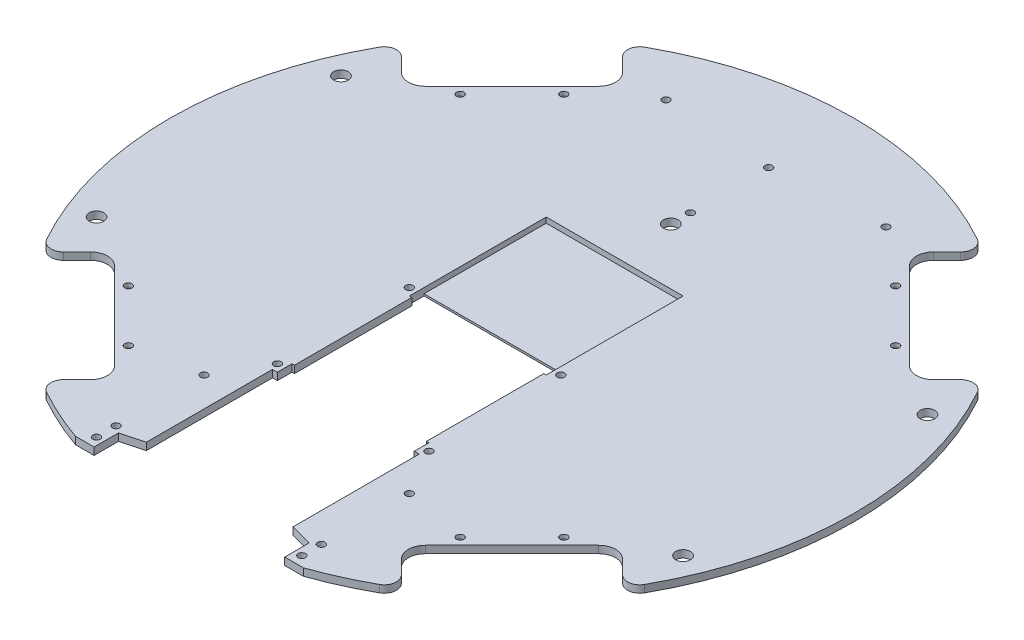
from build123d import *

# Parameters (mm, degrees)
SKETCH1_R                = 140
BOSS_EXTRUDE1_DEPTH      = 3
CUT_EXTRUDE4_REACH       = 200.013
CUT_EXTRUDE6_REACH       = 200.013
SKETCH9_R                = 1.5
FILLET1_R                = 5
CIRPATTERN1_COUNT        = 4
FILLET1_OF_CIRPATTERN1_R = 5
CUT_EXTRUDE1_REACH       = 200.013
FILLET3_R                = 1.5
CUT_EXTRUDE7_REACH       = 200.013
SKETCH10_R               = 1.5
CUT_EXTRUDE9_REACH       = 200.013
SKETCH13_R               = 1.5
CUT_EXTRUDE12_REACH      = 200.013
SKETCH16_R               = 1.5
SKETCH16_R_2             = 3
CUT_EXTRUDE13_REACH      = 200.013
SKETCH17_R               = 3
SKETCH18_W               = 56
SKETCH18_H               = 50
CUT_EXTRUDE14_DEPTH      = 2.2
CUT_EXTRUDE15_REACH      = 200.013
SKETCH19_R               = 1.5


with BuildPart() as part:
    # Sketch1 → Boss-Extrude1 (new body)
    with BuildSketch(Plane(origin=(0, 0, 0), x_dir=(1, 0, 0), z_dir=(0, 1, 0))):
        Circle(SKETCH1_R)
    extrude(amount=BOSS_EXTRUDE1_DEPTH)

    # Sketch7 → Cut-Extrude4 (cut, up to next)
    with BuildSketch(Plane(origin=(0, 3, 0), x_dir=(1, 0, 0), z_dir=(0, 1, 0)), mode=Mode.PRIVATE) as cut_extrude4_sk1:
        with BuildLine():
            Line((-99.030304705, -63.604254968), (-63.604254968, -99.030304705))
            ThreePointArc((-63.604254968, -99.030304705), (-61.568647097, -103.944696834), (-63.604254968, -108.859088964))
            Line((-63.604254968, -108.859088964), (-76.367532368, -121.622366364))
            Line((-76.367532368, -121.622366364), (-121.622366364, -76.367532368))
            Line((-121.622366364, -76.367532368), (-108.859088964, -63.604254968))
            ThreePointArc((-108.859088964, -63.604254968), (-103.944696834, -61.568647097), (-99.030304705, -63.604254968))
        make_face()
    cut_extrude4_tool1 = extrude(cut_extrude4_sk1.sketch, amount=-CUT_EXTRUDE4_REACH, mode=Mode.PRIVATE) & part.part
    cut_extrude4 = cut_extrude4_tool1.solids().sort_by_distance((-90.257735, 3, 90.257735))[0]
    add(cut_extrude4, mode=Mode.SUBTRACT)

    # Sketch9 → Cut-Extrude6 (cut, up to next)
    with BuildSketch(Plane(origin=(0, 3, 0), x_dir=(1, 0, 0), z_dir=(0, 1, 0)), mode=Mode.PRIVATE) as cut_extrude6_sk1:
        with Locations((-89.09545443, -67.882250994)):
            Circle(SKETCH9_R)
    cut_extrude6_tool1 = extrude(cut_extrude6_sk1.sketch, amount=-CUT_EXTRUDE6_REACH, mode=Mode.PRIVATE) & part.part
    # Sketch9 → Cut-Extrude6 (cut, up to next)
    with BuildSketch(Plane(origin=(0, 3, 0), x_dir=(1, 0, 0), z_dir=(0, 1, 0)), mode=Mode.PRIVATE) as cut_extrude6_sk2:
        with Locations((-67.882250994, -89.09545443)):
            Circle(SKETCH9_R)
    cut_extrude6_tool2 = extrude(cut_extrude6_sk2.sketch, amount=-CUT_EXTRUDE6_REACH, mode=Mode.PRIVATE) & part.part
    cut_extrude6_1 = cut_extrude6_tool1.solids().sort_by_distance((-89.095454, 3, 67.882251))[0]
    add(cut_extrude6_1, mode=Mode.SUBTRACT)
    cut_extrude6_2 = cut_extrude6_tool2.solids().sort_by_distance((-67.882251, 3, 89.095454))[0]
    add(cut_extrude6_2, mode=Mode.SUBTRACT)
    cut_extrude6 = cut_extrude6_1 + cut_extrude6_2  # Cut-Extrude6 as one shape, for the pattern or mirror that repeats it

    # Fillet1
    fillet1_edges = [part.edges().sort_by_distance(p)[0] for p in [
        (-73.746853427, 1.5, 119.001687423),
        (-119.001687423, 1.5, 73.746853427),
    ]]
    fillet(fillet1_edges, radius=FILLET1_R)

    # CirPattern1: Cut-Extrude4, Cut-Extrude6 ×4 about axis
    cirpattern1_axis = Axis((0, 3, 0), (0, 1, 0))
    add([cut_extrude4.rotate(cirpattern1_axis, i * 360 / CIRPATTERN1_COUNT) for i in range(1, CIRPATTERN1_COUNT)], mode=Mode.SUBTRACT)
    add([cut_extrude6.rotate(cirpattern1_axis, i * 360 / CIRPATTERN1_COUNT) for i in range(1, CIRPATTERN1_COUNT)], mode=Mode.SUBTRACT)

    # Fillet1 of CirPattern1
    fillet1_of_cirpattern1_edges = [part.edges().sort_by_distance(p)[0] for p in [
        (119.001687423, 1.5, 73.746853427),
        (73.746853427, 1.5, 119.001687423),
        (73.746853427, 1.5, -119.001687423),
        (119.001687423, 1.5, -73.746853427),
        (-119.001687423, 1.5, -73.746853427),
        (-73.746853427, 1.5, -119.001687423),
    ]]
    fillet(fillet1_of_cirpattern1_edges, radius=FILLET1_OF_CIRPATTERN1_R)

    # Sketch2 → Cut-Extrude1 (cut, up to next)
    with BuildSketch(Plane(origin=(0, 3, 0), x_dir=(1, 0, 0), z_dir=(0, 1, 0)), mode=Mode.PRIVATE) as cut_extrude1_sk1:
        Polygon((-46.647615159, -132), (-39, -132), (-39, -122), (-30, -119.588457268), (-30, -68), (-28, -68), (-28, -62), (-27, -62), (-27, -14), (-28, -14), (-28, -8), (28, -8), (28, -14), (27, -14), (27, -62), (28, -62), (28, -68), (30, -68), (30, -119.588457268), (39, -122), (39, -132), (46.647615159, -132), (46.647615159, -140), (-46.647615159, -140), align=None)
    cut_extrude1_tool1 = extrude(cut_extrude1_sk1.sketch, amount=-CUT_EXTRUDE1_REACH, mode=Mode.PRIVATE) & part.part
    add(cut_extrude1_tool1.solids().sort_by_distance((0, 3, 78.865183))[0], mode=Mode.SUBTRACT)

    # Fillet3
    fillet3_edges = [part.edges().sort_by_distance(p)[0] for p in [
        (67.882250994, 0, 90.59545443),
        (89.09545443, 0, 69.382250994),
        (90.59545443, 0, -67.882250994),
        (69.382250994, 0, -89.09545443),
        (-67.882250994, 0, -90.59545443),
        (-89.09545443, 0, -69.382250994),
        (-69.382250994, 0, 89.09545443),
        (-90.59545443, 0, 67.882250994),
    ]]
    fillet(fillet3_edges, radius=FILLET3_R)

    # Sketch10 → Cut-Extrude7 (cut, up to next)
    with BuildSketch(Plane(origin=(0, 3, 0), x_dir=(1, 0, 0), z_dir=(0, 1, 0)), mode=Mode.PRIVATE) as cut_extrude7_sk1:
        with Locations((-31, -65)):
            Circle(SKETCH10_R)
    cut_extrude7_tool1 = extrude(cut_extrude7_sk1.sketch, amount=-CUT_EXTRUDE7_REACH, mode=Mode.PRIVATE) & part.part
    # Sketch10 → Cut-Extrude7 (cut, up to next)
    with BuildSketch(Plane(origin=(0, 3, 0), x_dir=(1, 0, 0), z_dir=(0, 1, 0)), mode=Mode.PRIVATE) as cut_extrude7_sk2:
        with Locations((31, -65)):
            Circle(SKETCH10_R)
    cut_extrude7_tool2 = extrude(cut_extrude7_sk2.sketch, amount=-CUT_EXTRUDE7_REACH, mode=Mode.PRIVATE) & part.part
    # Sketch10 → Cut-Extrude7 (cut, up to next)
    with BuildSketch(Plane(origin=(0, 3, 0), x_dir=(1, 0, 0), z_dir=(0, 1, 0)), mode=Mode.PRIVATE) as cut_extrude7_sk3:
        with Locations((-31, -11)):
            Circle(SKETCH10_R)
    cut_extrude7_tool3 = extrude(cut_extrude7_sk3.sketch, amount=-CUT_EXTRUDE7_REACH, mode=Mode.PRIVATE) & part.part
    # Sketch10 → Cut-Extrude7 (cut, up to next)
    with BuildSketch(Plane(origin=(0, 3, 0), x_dir=(1, 0, 0), z_dir=(0, 1, 0)), mode=Mode.PRIVATE) as cut_extrude7_sk4:
        with Locations((31, -11)):
            Circle(SKETCH10_R)
    cut_extrude7_tool4 = extrude(cut_extrude7_sk4.sketch, amount=-CUT_EXTRUDE7_REACH, mode=Mode.PRIVATE) & part.part
    add(cut_extrude7_tool1.solids().sort_by_distance((-31, 3, 65))[0], mode=Mode.SUBTRACT)
    add(cut_extrude7_tool2.solids().sort_by_distance((31, 3, 65))[0], mode=Mode.SUBTRACT)
    add(cut_extrude7_tool3.solids().sort_by_distance((-31, 3, 11))[0], mode=Mode.SUBTRACT)
    add(cut_extrude7_tool4.solids().sort_by_distance((31, 3, 11))[0], mode=Mode.SUBTRACT)

    # Sketch13 → Cut-Extrude9 (cut, up to next)
    with BuildSketch(Plane(origin=(0, 3, 0), x_dir=(1, 0, 0), z_dir=(0, 1, 0)), mode=Mode.PRIVATE) as cut_extrude9_sk1:
        with Locations((-42, -84)):
            Circle(SKETCH13_R)
    cut_extrude9_tool1 = extrude(cut_extrude9_sk1.sketch, amount=-CUT_EXTRUDE9_REACH, mode=Mode.PRIVATE) & part.part
    # Sketch13 → Cut-Extrude9 (cut, up to next)
    with BuildSketch(Plane(origin=(0, 3, 0), x_dir=(1, 0, 0), z_dir=(0, 1, 0)), mode=Mode.PRIVATE) as cut_extrude9_sk2:
        with Locations((-42, -120)):
            Circle(SKETCH13_R)
    cut_extrude9_tool2 = extrude(cut_extrude9_sk2.sketch, amount=-CUT_EXTRUDE9_REACH, mode=Mode.PRIVATE) & part.part
    # Sketch13 → Cut-Extrude9 (cut, up to next)
    with BuildSketch(Plane(origin=(0, 3, 0), x_dir=(1, 0, 0), z_dir=(0, 1, 0)), mode=Mode.PRIVATE) as cut_extrude9_sk3:
        with Locations((42, -120)):
            Circle(SKETCH13_R)
    cut_extrude9_tool3 = extrude(cut_extrude9_sk3.sketch, amount=-CUT_EXTRUDE9_REACH, mode=Mode.PRIVATE) & part.part
    # Sketch13 → Cut-Extrude9 (cut, up to next)
    with BuildSketch(Plane(origin=(0, 3, 0), x_dir=(1, 0, 0), z_dir=(0, 1, 0)), mode=Mode.PRIVATE) as cut_extrude9_sk4:
        with Locations((42, -84)):
            Circle(SKETCH13_R)
    cut_extrude9_tool4 = extrude(cut_extrude9_sk4.sketch, amount=-CUT_EXTRUDE9_REACH, mode=Mode.PRIVATE) & part.part
    add(cut_extrude9_tool1.solids().sort_by_distance((-42, 3, 84))[0], mode=Mode.SUBTRACT)
    add(cut_extrude9_tool2.solids().sort_by_distance((-42, 3, 120))[0], mode=Mode.SUBTRACT)
    add(cut_extrude9_tool3.solids().sort_by_distance((42, 3, 120))[0], mode=Mode.SUBTRACT)
    add(cut_extrude9_tool4.solids().sort_by_distance((42, 3, 84))[0], mode=Mode.SUBTRACT)

    # Sketch16 → Cut-Extrude12 (cut, up to next)
    with BuildSketch(Plane(origin=(0, 3, 0), x_dir=(1, 0, 0), z_dir=(0, 1, 0)), mode=Mode.PRIVATE) as cut_extrude12_sk1:
        with Locations((0, 73)):
            Circle(SKETCH16_R)
    cut_extrude12_tool1 = extrude(cut_extrude12_sk1.sketch, amount=-CUT_EXTRUDE12_REACH, mode=Mode.PRIVATE) & part.part
    # Sketch16 → Cut-Extrude12 (cut, up to next)
    with BuildSketch(Plane(origin=(0, 3, 0), x_dir=(1, 0, 0), z_dir=(0, 1, 0)), mode=Mode.PRIVATE) as cut_extrude12_sk2:
        with Locations((-45, 108)):
            Circle(SKETCH16_R)
    cut_extrude12_tool2 = extrude(cut_extrude12_sk2.sketch, amount=-CUT_EXTRUDE12_REACH, mode=Mode.PRIVATE) & part.part
    # Sketch16 → Cut-Extrude12 (cut, up to next)
    with BuildSketch(Plane(origin=(0, 3, 0), x_dir=(1, 0, 0), z_dir=(0, 1, 0)), mode=Mode.PRIVATE) as cut_extrude12_sk3:
        with Locations((45, 108)):
            Circle(SKETCH16_R)
    cut_extrude12_tool3 = extrude(cut_extrude12_sk3.sketch, amount=-CUT_EXTRUDE12_REACH, mode=Mode.PRIVATE) & part.part
    # Sketch16 → Cut-Extrude12 (cut, up to next)
    with BuildSketch(Plane(origin=(0, 3, 0), x_dir=(1, 0, 0), z_dir=(0, 1, 0)), mode=Mode.PRIVATE) as cut_extrude12_sk4:
        with Locations((0, 105)):
            Circle(SKETCH16_R)
    cut_extrude12_tool4 = extrude(cut_extrude12_sk4.sketch, amount=-CUT_EXTRUDE12_REACH, mode=Mode.PRIVATE) & part.part
    # Sketch16 → Cut-Extrude12 (cut, up to next)
    with BuildSketch(Plane(origin=(0, 3, 0), x_dir=(1, 0, 0), z_dir=(0, 1, 0)), mode=Mode.PRIVATE) as cut_extrude12_sk5:
        with Locations((0, 65)):
            Circle(SKETCH16_R_2)
    cut_extrude12_tool5 = extrude(cut_extrude12_sk5.sketch, amount=-CUT_EXTRUDE12_REACH, mode=Mode.PRIVATE) & part.part
    add(cut_extrude12_tool1.solids().sort_by_distance((0, 3, -73))[0], mode=Mode.SUBTRACT)
    add(cut_extrude12_tool2.solids().sort_by_distance((-45, 3, -108))[0], mode=Mode.SUBTRACT)
    add(cut_extrude12_tool3.solids().sort_by_distance((45, 3, -108))[0], mode=Mode.SUBTRACT)
    add(cut_extrude12_tool4.solids().sort_by_distance((0, 3, -105))[0], mode=Mode.SUBTRACT)
    add(cut_extrude12_tool5.solids().sort_by_distance((0, 3, -65))[0], mode=Mode.SUBTRACT)

    # Sketch17 → Cut-Extrude13 (cut, up to next)
    with BuildSketch(Plane(origin=(0, 3, 0), x_dir=(1, 0, 0), z_dir=(0, 1, 0)), mode=Mode.PRIVATE) as cut_extrude13_sk1:
        with Locations((-120, 50)):
            Circle(SKETCH17_R)
    cut_extrude13_tool1 = extrude(cut_extrude13_sk1.sketch, amount=-CUT_EXTRUDE13_REACH, mode=Mode.PRIVATE) & part.part
    # Sketch17 → Cut-Extrude13 (cut, up to next)
    with BuildSketch(Plane(origin=(0, 3, 0), x_dir=(1, 0, 0), z_dir=(0, 1, 0)), mode=Mode.PRIVATE) as cut_extrude13_sk2:
        with Locations((-120, -50)):
            Circle(SKETCH17_R)
    cut_extrude13_tool2 = extrude(cut_extrude13_sk2.sketch, amount=-CUT_EXTRUDE13_REACH, mode=Mode.PRIVATE) & part.part
    # Sketch17 → Cut-Extrude13 (cut, up to next)
    with BuildSketch(Plane(origin=(0, 3, 0), x_dir=(1, 0, 0), z_dir=(0, 1, 0)), mode=Mode.PRIVATE) as cut_extrude13_sk3:
        with Locations((120, 50)):
            Circle(SKETCH17_R)
    cut_extrude13_tool3 = extrude(cut_extrude13_sk3.sketch, amount=-CUT_EXTRUDE13_REACH, mode=Mode.PRIVATE) & part.part
    # Sketch17 → Cut-Extrude13 (cut, up to next)
    with BuildSketch(Plane(origin=(0, 3, 0), x_dir=(1, 0, 0), z_dir=(0, 1, 0)), mode=Mode.PRIVATE) as cut_extrude13_sk4:
        with Locations((120, -50)):
            Circle(SKETCH17_R)
    cut_extrude13_tool4 = extrude(cut_extrude13_sk4.sketch, amount=-CUT_EXTRUDE13_REACH, mode=Mode.PRIVATE) & part.part
    add(cut_extrude13_tool1.solids().sort_by_distance((-120, 3, -50))[0], mode=Mode.SUBTRACT)
    add(cut_extrude13_tool2.solids().sort_by_distance((-120, 3, 50))[0], mode=Mode.SUBTRACT)
    add(cut_extrude13_tool3.solids().sort_by_distance((120, 3, -50))[0], mode=Mode.SUBTRACT)
    add(cut_extrude13_tool4.solids().sort_by_distance((120, 3, 50))[0], mode=Mode.SUBTRACT)

    # Sketch18 → Cut-Extrude14 (cut)
    with BuildSketch(Plane(origin=(0, 3, 0), x_dir=(1, 0, 0), z_dir=(0, 1, 0))):
        with Locations((0, 17)):
            Rectangle(SKETCH18_W, SKETCH18_H)
    extrude(amount=-CUT_EXTRUDE14_DEPTH, mode=Mode.SUBTRACT)

    # Sketch19 → Cut-Extrude15 (cut, up to next)
    with BuildSketch(Plane(origin=(0, 3, 0), x_dir=(1, 0, 0), z_dir=(0, 1, 0)), mode=Mode.PRIVATE) as cut_extrude15_sk1:
        with Locations((-42, -128)):
            Circle(SKETCH19_R)
    cut_extrude15_tool1 = extrude(cut_extrude15_sk1.sketch, amount=-CUT_EXTRUDE15_REACH, mode=Mode.PRIVATE) & part.part
    # Sketch19 → Cut-Extrude15 (cut, up to next)
    with BuildSketch(Plane(origin=(0, 3, 0), x_dir=(1, 0, 0), z_dir=(0, 1, 0)), mode=Mode.PRIVATE) as cut_extrude15_sk2:
        with Locations((42, -128)):
            Circle(SKETCH19_R)
    cut_extrude15_tool2 = extrude(cut_extrude15_sk2.sketch, amount=-CUT_EXTRUDE15_REACH, mode=Mode.PRIVATE) & part.part
    add(cut_extrude15_tool1.solids().sort_by_distance((-42, 3, 128))[0], mode=Mode.SUBTRACT)
    add(cut_extrude15_tool2.solids().sort_by_distance((42, 3, 128))[0], mode=Mode.SUBTRACT)


solid = part.part
